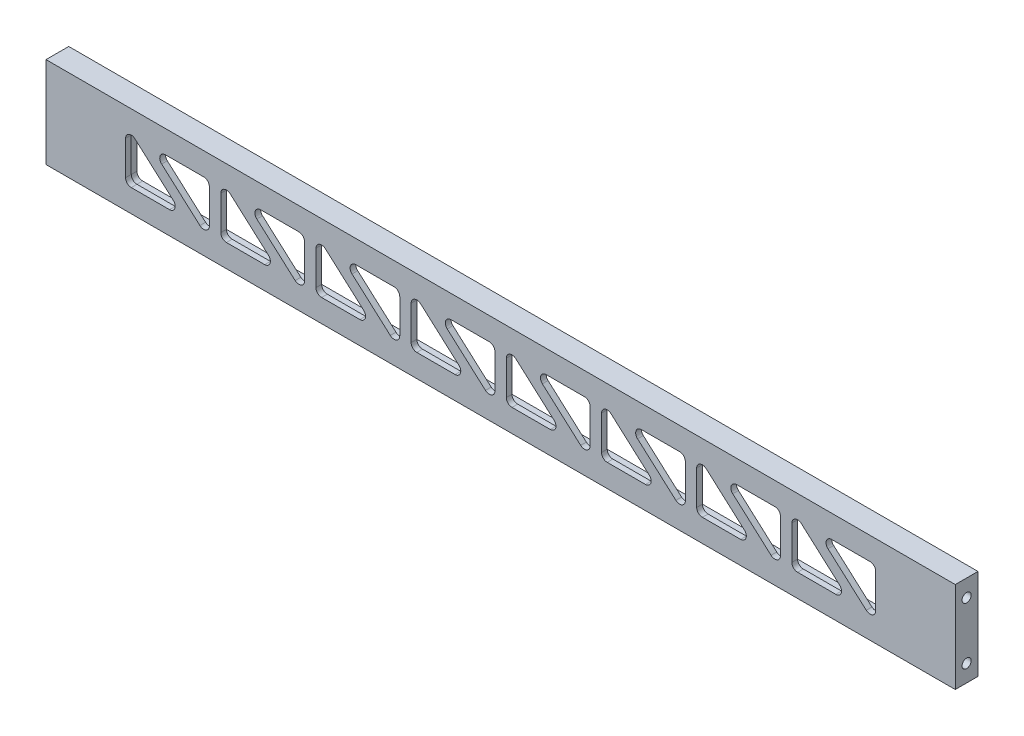
from build123d import *

# Parameters (mm, degrees)
SKETCH1_W                             = 12.7
SKETCH1_H                             = 50.8
BOSS_EXTRUDE1_DEPTH                   = 254
F_1_4_20_TAPPED_HOLE1_D               = 5.1054
F_1_4_20_TAPPED_HOLE1_DEPTH           = 29.21
F_1_4_20_TAPPED_HOLE1_TIP             = 1.533816902
F_1_4_20_TAPPED_HOLE1_ON_FACE_2_D     = 5.1054
F_1_4_20_TAPPED_HOLE1_ON_FACE_2_DEPTH = 29.21
F_1_4_20_TAPPED_HOLE1_ON_FACE_2_TIP   = 1.533816902
CUT_EXTRUDE1_DEPTH                    = 9.525
CUT_EXTRUDE2_DEPTH                    = 260.205257711


with BuildPart() as part:
    # Sketch1 → Boss-Extrude1 (new, symmetric)
    with BuildSketch(Plane(origin=(0, 0, 0), x_dir=(0, 0, -1), z_dir=(1, 0, 0))):
        with Locations((6.35, 25.4)):
            Rectangle(SKETCH1_W, SKETCH1_H)
    extrude(amount=BOSS_EXTRUDE1_DEPTH, both=True)

    # 1/4-20 Tapped Hole1
    with Locations(Plane(origin=(254, 41.275, -6.35), x_dir=(0, 0, 1), z_dir=(1, 0, 0))):
        with Locations((0, 0), (0, 31.75)):
            Hole(F_1_4_20_TAPPED_HOLE1_D / 2, depth=F_1_4_20_TAPPED_HOLE1_DEPTH)
            with Locations((0, 0, -(F_1_4_20_TAPPED_HOLE1_DEPTH + F_1_4_20_TAPPED_HOLE1_TIP / 2))):  # 118° drill point
                Cone(0, F_1_4_20_TAPPED_HOLE1_D / 2, F_1_4_20_TAPPED_HOLE1_TIP, mode=Mode.SUBTRACT)

    # 1/4-20 Tapped Hole1 on face 2
    with Locations(Plane(origin=(-254, 9.525, -6.35), x_dir=(0, 0, -1), z_dir=(-1, 0, 0))):
        with Locations((0, 0), (0, -31.75)):
            Hole(F_1_4_20_TAPPED_HOLE1_ON_FACE_2_D / 2, depth=F_1_4_20_TAPPED_HOLE1_ON_FACE_2_DEPTH)
            with Locations((0, 0, -(F_1_4_20_TAPPED_HOLE1_ON_FACE_2_DEPTH + F_1_4_20_TAPPED_HOLE1_ON_FACE_2_TIP / 2))):  # 118° drill point
                Cone(0, F_1_4_20_TAPPED_HOLE1_ON_FACE_2_D / 2, F_1_4_20_TAPPED_HOLE1_ON_FACE_2_TIP, mode=Mode.SUBTRACT)

    # Sketch4 → Cut-Extrude1 (cut)
    with BuildSketch(Plane(origin=(0, 0, -12.7), x_dir=(-1, 0, 0), z_dir=(0, 0, -1))):
        with BuildLine():
            Line((212.725, 44.45), (-212.725, 44.45))
            ThreePointArc((-212.725, 44.45), (-214.97006403, 43.52006403), (-215.9, 41.275))
            Line((-215.9, 41.275), (-215.9, 9.525))
            ThreePointArc((-215.9, 9.525), (-214.97006403, 7.27993597), (-212.725, 6.35))
            Line((-212.725, 6.35), (212.725, 6.35))
            ThreePointArc((212.725, 6.35), (214.97006403, 7.27993597), (215.9, 9.525))
            Line((215.9, 9.525), (215.9, 41.275))
            ThreePointArc((215.9, 41.275), (214.97006403, 43.52006403), (212.725, 44.45))
        make_face()
    extrude(amount=-CUT_EXTRUDE1_DEPTH, mode=Mode.SUBTRACT)

    # Sketch5 → Cut-Extrude2 (cut, through all)
    with BuildSketch(Plane(origin=(0, 0, -3.175), x_dir=(-1, 0, 0), z_dir=(0, 0, -1))):
        with BuildLine():
            Line((-209.55, 34.925), (-209.55, 15.875))
            ThreePointArc((-209.55, 15.875), (-207.674177104, 12.977973274), (-204.26321962, 13.504133359))
            Line((-204.26321962, 13.504133359), (-182.876047955, 32.554133359))
            ThreePointArc((-182.876047955, 32.554133359), (-182.020664152, 36.054850303), (-184.987828335, 38.1))
            Line((-184.987828335, 38.1), (-206.375, 38.1))
            ThreePointArc((-206.375, 38.1), (-208.62006403, 37.17006403), (-209.55, 34.925))
        make_face()
        with BuildLine():
            Line((-189.392702045, 18.245866641), (-168.00553038, 37.295866641))
            ThreePointArc((-168.00553038, 37.295866641), (-164.594572896, 37.822026726), (-162.71875, 34.925))
            Line((-162.71875, 34.925), (-162.71875, 15.875))
            ThreePointArc((-162.71875, 15.875), (-163.64868597, 13.62993597), (-165.89375, 12.7))
            Line((-165.89375, 12.7), (-187.280921665, 12.7))
            ThreePointArc((-187.280921665, 12.7), (-190.248085848, 14.745149697), (-189.392702045, 18.245866641))
        make_face()
        with BuildLine():
            Line((-156.36875, 34.925), (-156.36875, 15.875))
            ThreePointArc((-156.36875, 15.875), (-154.492927104, 12.977973274), (-151.08196962, 13.504133359))
            Line((-151.08196962, 13.504133359), (-129.694797955, 32.554133359))
            ThreePointArc((-129.694797955, 32.554133359), (-128.839414152, 36.054850303), (-131.806578335, 38.1))
            Line((-131.806578335, 38.1), (-153.19375, 38.1))
            ThreePointArc((-153.19375, 38.1), (-155.43881403, 37.17006403), (-156.36875, 34.925))
        make_face()
        with BuildLine():
            Line((-136.211452045, 18.245866641), (-114.82428038, 37.295866641))
            ThreePointArc((-114.82428038, 37.295866641), (-111.413322896, 37.822026726), (-109.5375, 34.925))
            Line((-109.5375, 34.925), (-109.5375, 15.875))
            ThreePointArc((-109.5375, 15.875), (-110.46743597, 13.62993597), (-112.7125, 12.7))
            Line((-112.7125, 12.7), (-134.099671665, 12.7))
            ThreePointArc((-134.099671665, 12.7), (-137.066835848, 14.745149697), (-136.211452045, 18.245866641))
        make_face()
        with BuildLine():
            Line((-103.1875, 34.925), (-103.1875, 15.875))
            ThreePointArc((-103.1875, 15.875), (-101.311677104, 12.977973274), (-97.90071962, 13.504133359))
            Line((-97.90071962, 13.504133359), (-76.513547955, 32.554133359))
            ThreePointArc((-76.513547955, 32.554133359), (-75.658164152, 36.054850303), (-78.625328335, 38.1))
            Line((-78.625328335, 38.1), (-100.0125, 38.1))
            ThreePointArc((-100.0125, 38.1), (-102.25756403, 37.17006403), (-103.1875, 34.925))
        make_face()
        with BuildLine():
            Line((-83.030202045, 18.245866641), (-61.64303038, 37.295866641))
            ThreePointArc((-61.64303038, 37.295866641), (-58.232072896, 37.822026726), (-56.35625, 34.925))
            Line((-56.35625, 34.925), (-56.35625, 15.875))
            ThreePointArc((-56.35625, 15.875), (-57.28618597, 13.62993597), (-59.53125, 12.7))
            Line((-59.53125, 12.7), (-80.918421665, 12.7))
            ThreePointArc((-80.918421665, 12.7), (-83.885585848, 14.745149697), (-83.030202045, 18.245866641))
        make_face()
        with BuildLine():
            Line((-50.00625, 34.925), (-50.00625, 15.875))
            ThreePointArc((-50.00625, 15.875), (-48.130427104, 12.977973274), (-44.71946962, 13.504133359))
            Line((-44.71946962, 13.504133359), (-23.332297955, 32.554133359))
            ThreePointArc((-23.332297955, 32.554133359), (-22.476914152, 36.054850303), (-25.444078335, 38.1))
            Line((-25.444078335, 38.1), (-46.83125, 38.1))
            ThreePointArc((-46.83125, 38.1), (-49.07631403, 37.17006403), (-50.00625, 34.925))
        make_face()
        with BuildLine():
            Line((-29.848952045, 18.245866641), (-8.46178038, 37.295866641))
            ThreePointArc((-8.46178038, 37.295866641), (-5.050822896, 37.822026726), (-3.175, 34.925))
            Line((-3.175, 34.925), (-3.175, 15.875))
            ThreePointArc((-3.175, 15.875), (-4.10493597, 13.62993597), (-6.35, 12.7))
            Line((-6.35, 12.7), (-27.737171665, 12.7))
            ThreePointArc((-27.737171665, 12.7), (-30.704335848, 14.745149697), (-29.848952045, 18.245866641))
        make_face()
        with BuildLine():
            Line((3.175, 34.925), (3.175, 15.875))
            ThreePointArc((3.175, 15.875), (5.050822896, 12.977973274), (8.46178038, 13.504133359))
            Line((8.46178038, 13.504133359), (29.848952045, 32.554133359))
            ThreePointArc((29.848952045, 32.554133359), (30.704335848, 36.054850303), (27.737171665, 38.1))
            Line((27.737171665, 38.1), (6.35, 38.1))
            ThreePointArc((6.35, 38.1), (4.10493597, 37.17006403), (3.175, 34.925))
        make_face()
        with BuildLine():
            Line((23.332297955, 18.245866641), (44.71946962, 37.295866641))
            ThreePointArc((44.71946962, 37.295866641), (48.130427104, 37.822026726), (50.00625, 34.925))
            Line((50.00625, 34.925), (50.00625, 15.875))
            ThreePointArc((50.00625, 15.875), (49.07631403, 13.62993597), (46.83125, 12.7))
            Line((46.83125, 12.7), (25.444078335, 12.7))
            ThreePointArc((25.444078335, 12.7), (22.476914152, 14.745149697), (23.332297955, 18.245866641))
        make_face()
        with BuildLine():
            Line((56.35625, 34.925), (56.35625, 15.875))
            ThreePointArc((56.35625, 15.875), (58.232072896, 12.977973274), (61.64303038, 13.504133359))
            Line((61.64303038, 13.504133359), (83.030202045, 32.554133359))
            ThreePointArc((83.030202045, 32.554133359), (83.885585848, 36.054850303), (80.918421665, 38.1))
            Line((80.918421665, 38.1), (59.53125, 38.1))
            ThreePointArc((59.53125, 38.1), (57.28618597, 37.17006403), (56.35625, 34.925))
        make_face()
        with BuildLine():
            Line((76.513547955, 18.245866641), (97.90071962, 37.295866641))
            ThreePointArc((97.90071962, 37.295866641), (101.311677104, 37.822026726), (103.1875, 34.925))
            Line((103.1875, 34.925), (103.1875, 15.875))
            ThreePointArc((103.1875, 15.875), (102.25756403, 13.62993597), (100.0125, 12.7))
            Line((100.0125, 12.7), (78.625328335, 12.7))
            ThreePointArc((78.625328335, 12.7), (75.658164152, 14.745149697), (76.513547955, 18.245866641))
        make_face()
        with BuildLine():
            Line((109.5375, 34.925), (109.5375, 15.875))
            ThreePointArc((109.5375, 15.875), (111.413322896, 12.977973274), (114.82428038, 13.504133359))
            Line((114.82428038, 13.504133359), (136.211452045, 32.554133359))
            ThreePointArc((136.211452045, 32.554133359), (137.066835848, 36.054850303), (134.099671665, 38.1))
            Line((134.099671665, 38.1), (112.7125, 38.1))
            ThreePointArc((112.7125, 38.1), (110.46743597, 37.17006403), (109.5375, 34.925))
        make_face()
        with BuildLine():
            Line((129.694797955, 18.245866641), (151.08196962, 37.295866641))
            ThreePointArc((151.08196962, 37.295866641), (154.492927104, 37.822026726), (156.36875, 34.925))
            Line((156.36875, 34.925), (156.36875, 15.875))
            ThreePointArc((156.36875, 15.875), (155.43881403, 13.62993597), (153.19375, 12.7))
            Line((153.19375, 12.7), (131.806578335, 12.7))
            ThreePointArc((131.806578335, 12.7), (128.839414152, 14.745149697), (129.694797955, 18.245866641))
        make_face()
        with BuildLine():
            Line((162.71875, 34.925), (162.71875, 15.875))
            ThreePointArc((162.71875, 15.875), (164.594572896, 12.977973274), (168.00553038, 13.504133359))
            Line((168.00553038, 13.504133359), (189.392702045, 32.554133359))
            ThreePointArc((189.392702045, 32.554133359), (190.248085848, 36.054850303), (187.280921665, 38.1))
            Line((187.280921665, 38.1), (165.89375, 38.1))
            ThreePointArc((165.89375, 38.1), (163.64868597, 37.17006403), (162.71875, 34.925))
        make_face()
        with BuildLine():
            Line((182.876047955, 18.245866641), (204.26321962, 37.295866641))
            ThreePointArc((204.26321962, 37.295866641), (207.674177104, 37.822026726), (209.55, 34.925))
            Line((209.55, 34.925), (209.55, 15.875))
            ThreePointArc((209.55, 15.875), (208.62006403, 13.62993597), (206.375, 12.7))
            Line((206.375, 12.7), (184.987828335, 12.7))
            ThreePointArc((184.987828335, 12.7), (182.020664152, 14.745149697), (182.876047955, 18.245866641))
        make_face()
    extrude(amount=-CUT_EXTRUDE2_DEPTH, mode=Mode.SUBTRACT)


solid = part.part
